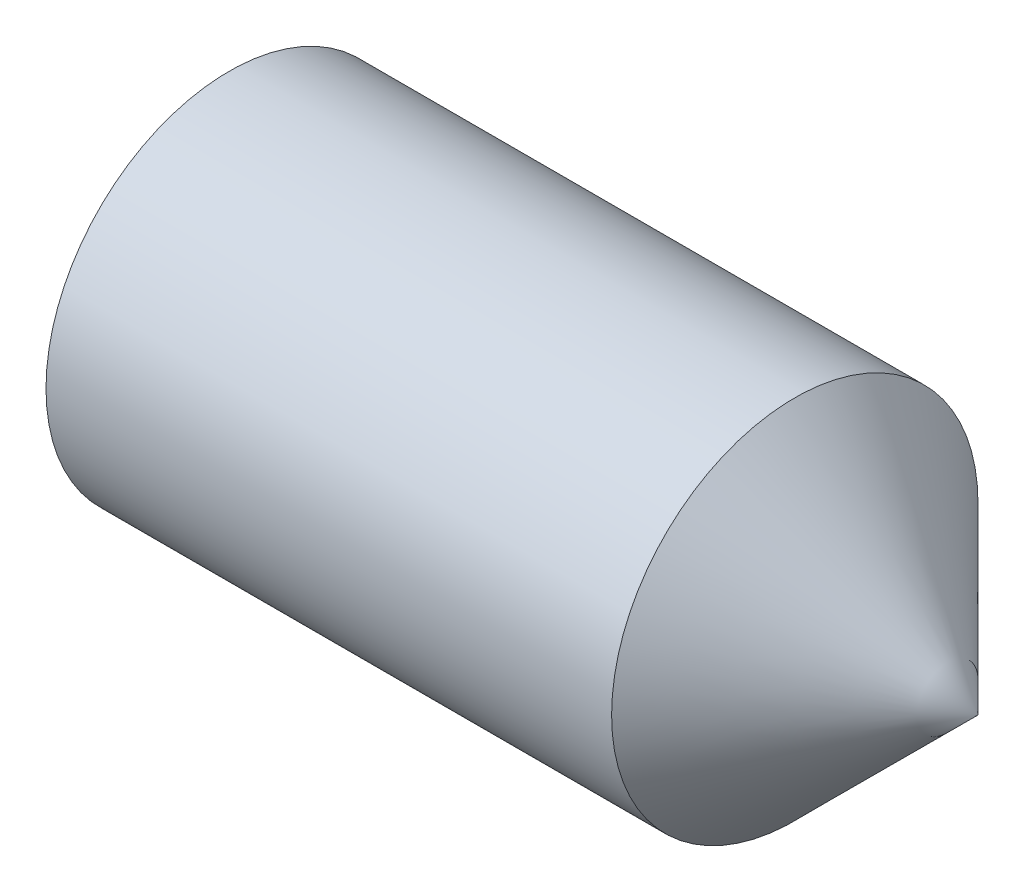
from build123d import *

# Parameters (mm, degrees)
HEX_2_DEPTH = 15


with BuildPart() as part:
    # BodySke → BaseBody (revolve)
    with BuildSketch(Plane.XY):
        Polygon((0, 0), (0, 10.352), (0.951473244, 12), (38, 12), (50, 0), align=None)
    revolve(axis=Axis((-12.7, 0, 0), (1, 0, 0)))

    # Sketch2 → Hex 2 (cut)
    with BuildSketch(Plane.ZY):
        Polygon((3.464101615, 6), (-3.464101615, 6), (-6.92820323, 0), (-3.464101615, -6), (3.464101615, -6), (6.92820323, 0), align=None)
    extrude(amount=-HEX_2_DEPTH, mode=Mode.SUBTRACT)


solid = part.part
